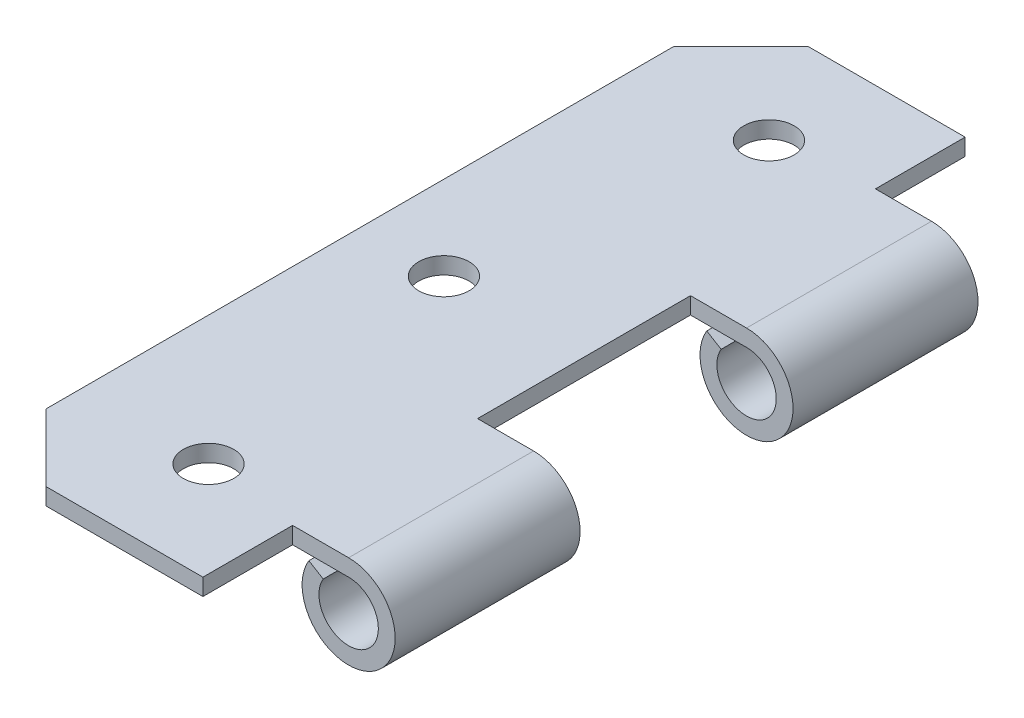
from build123d import *

# Parameters (mm, degrees)
TABAN_FLAN_1_DEPTH    = 34
IZIM9_W               = 9.15
IZIM9_H               = 8
IZIM9_H_2             = 19
KES_EKSTR_ZYON1_DEPTH = 39.757096124
IZIM11_R              = 2.25
KES_EKSTR_ZYON2_DEPTH = 10
RADYUS1_SIZE          = 6


# Sheet-metal steps are written as plain solids
with BuildPart() as part:
    # Çizim1 → Taban-Flanş1 (new, symmetric)
    with BuildSketch(Plane.XY):
        with BuildLine():
            Line((-12.5, 0), (12.5, 0))
            ThreePointArc((12.5, 0), (14.537154879, -7.765591238), (8.95035213, -2))
            Line((8.95035213, -2), (10.233357384, -2.777108434))
            ThreePointArc((10.233357384, -2.777108434), (13.800833838, -6.458751031), (12.5, -1.5))
            Line((12.5, -1.5), (-12.5, -1.5))
            Line((-12.5, -1.5), (-12.5, 0))
        make_face()
    extrude(amount=TABAN_FLAN_1_DEPTH, both=True)

    # Çizim9 → Kes-Ekstrüzyon1 (cut, through all)
    with BuildSketch(Plane(origin=(0, 0, 0), x_dir=(1, 0, 0), z_dir=(0, 1, 0))):
        with Locations((12.075, 30)):
            Rectangle(IZIM9_W, IZIM9_H)
        with Locations((12.075, -30)):
            Rectangle(IZIM9_W, IZIM9_H)
        with Locations((12.075, 0)):
            Rectangle(IZIM9_W, IZIM9_H_2)
    extrude(amount=-KES_EKSTR_ZYON1_DEPTH, mode=Mode.SUBTRACT)

    # Çizim11 → Kes-Ekstrüzyon2 (cut)
    with BuildSketch(Plane(origin=(0, 0, 0), x_dir=(1, 0, 0), z_dir=(0, 1, 0))):
        with Locations(Location((-1, 25, 0), (0, 0, 180))):
            Circle(IZIM11_R)
        with Locations(Location((-1, -25, 0), (0, 0, 180))):
            Circle(IZIM11_R)
        with Locations(Location((-5, 0, 0), (0, 0, 180))):
            Circle(IZIM11_R)
    extrude(amount=-KES_EKSTR_ZYON2_DEPTH, mode=Mode.SUBTRACT)

    # Radyus1
    radyus1_edges = [part.edges().sort_by_distance(p)[0] for p in [
        (-12.5, -0.75, 34),
        (-12.5, -0.75, -34),
    ]]
    chamfer(radyus1_edges, length=RADYUS1_SIZE)


solid = part.part
